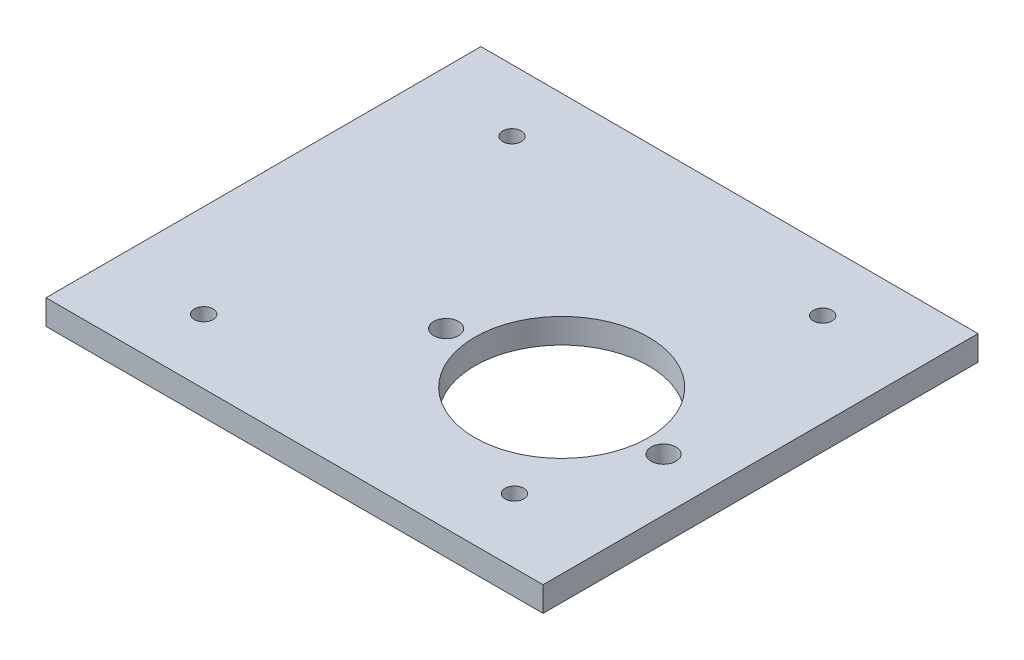
from build123d import *

# Parameters (mm, degrees)
SKETCH1_W           = 80
SKETCH1_H           = 70
SKETCH1_R           = 1.5
SKETCH1_R_2         = 2
SKETCH1_R_3         = 14
BOSS_EXTRUDE4_DEPTH = 4


with BuildPart() as part:
    # Sketch1 → Boss-Extrude4 (new body)
    with BuildSketch(Plane(origin=(0, 0, 0), x_dir=(1, 0, 0), z_dir=(0, 1, 0))):
        Rectangle(SKETCH1_W, SKETCH1_H)
        with Locations((-25, -24.60667729)):
            Circle(SKETCH1_R, mode=Mode.SUBTRACT)
        with Locations((25, -24.60667729)):
            Circle(SKETCH1_R, mode=Mode.SUBTRACT)
        with Locations((31.5, -7.102660735)):
            Circle(SKETCH1_R_2, mode=Mode.SUBTRACT)
        with Locations((14, -6)):
            Circle(SKETCH1_R_3, mode=Mode.SUBTRACT)
        with Locations((-25, 25)):
            Circle(SKETCH1_R, mode=Mode.SUBTRACT)
        with Locations((25, 25)):
            Circle(SKETCH1_R, mode=Mode.SUBTRACT)
        with Locations((-3.5, -7.102660735)):
            Circle(SKETCH1_R_2, mode=Mode.SUBTRACT)
    extrude(amount=BOSS_EXTRUDE4_DEPTH)


solid = part.part
